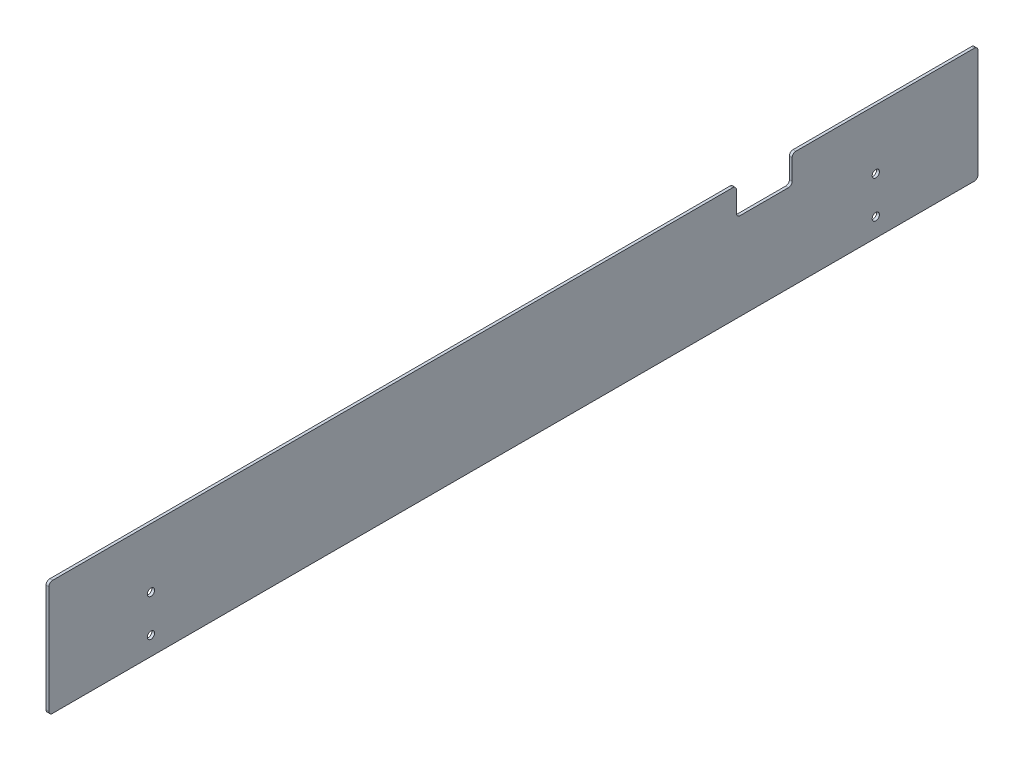
from build123d import *

# Parameters (mm, degrees)
BOSS_EXTRUDE1_DEPTH = 1.5
FILLET1_R           = 2
SKETCH2_R           = 1.95
CUT_EXTRUDE1_DEPTH  = 10


with BuildPart() as part:
    # Sketch1 → Boss-Extrude1 (new body)
    with BuildSketch(Plane(origin=(0, 0, 0), x_dir=(0, 0, -1), z_dir=(1, 0, 0))):
        Polygon((130.053191489, -78.292553191), (230.053191489, -78.292553191), (230.053191489, -140.292553191), (-269.946808511, -140.292553191), (-269.946808511, -78.292553191), (100.053191489, -78.292553191), (100.053191489, -93.292553191), (130.053191489, -93.292553191), align=None)
    extrude(amount=BOSS_EXTRUDE1_DEPTH)

    # Fillet1
    fillet1_edges = [part.edges().sort_by_distance(p)[0] for p in [
        (0.75, -140.292553191, -230.053191489),
        (0.75, -140.292553191, 269.946808511),
        (0.75, -78.292553191, 269.946808511),
        (0.75, -78.292553191, -100.053191489),
        (0.75, -93.292553191, -100.053191489),
        (0.75, -93.292553191, -130.053191489),
        (0.75, -78.292553191, -130.053191489),
        (0.75, -78.292553191, -230.053191489),
    ]]
    fillet(fillet1_edges, radius=FILLET1_R)

    # Sketch2 → Cut-Extrude1 (cut)
    with BuildSketch(Plane.ZY):
        with Locations((-175.053191489, -110.292553191)):
            Circle(SKETCH2_R)
        with Locations((-175.053191489, -130.292553191)):
            Circle(SKETCH2_R)
        with Locations((214.946808511, -110.292553191)):
            Circle(SKETCH2_R)
        with Locations((214.946808511, -130.292553191)):
            Circle(SKETCH2_R)
    extrude(amount=-CUT_EXTRUDE1_DEPTH, mode=Mode.SUBTRACT)


solid = part.part
